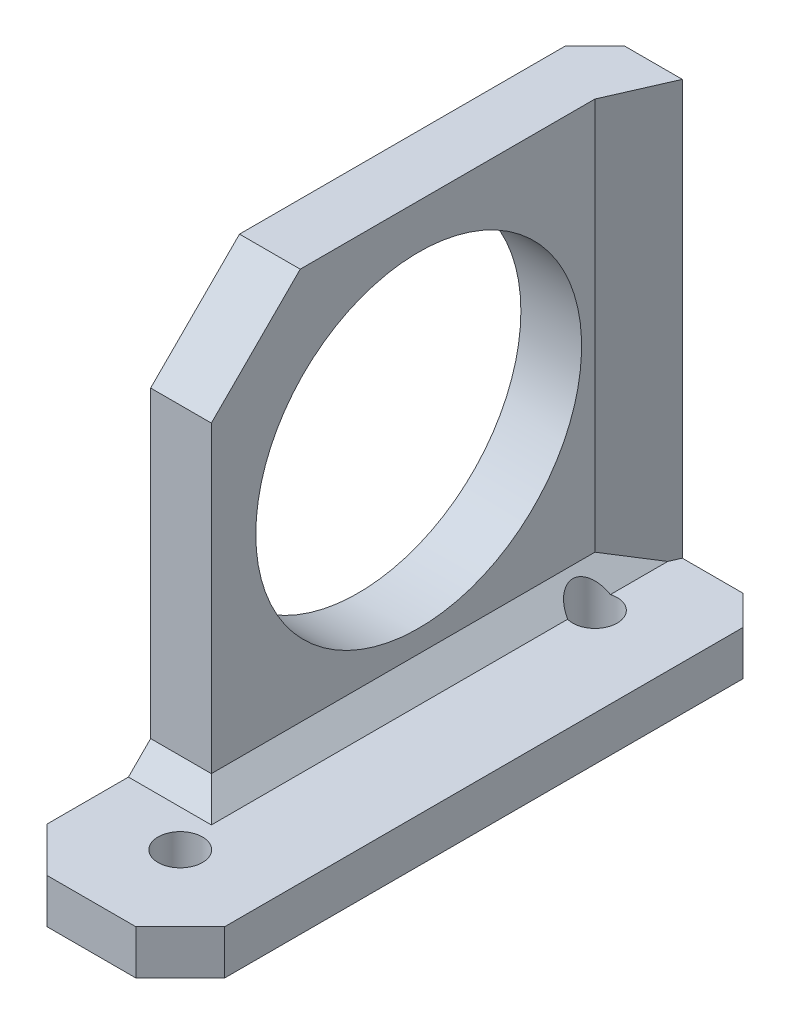
from build123d import *

# Parameters (mm, degrees)
SKETCH1_R                = 1.5
BOSS_EXTRUDE1_DEPTH      = 3
BOSS_EXTRUDE2_DEPTH      = 28
CHAMFER1_SIZE            = 2
SKETCH4_R                = 11
CUT_EXTRUDE1_DEPTH       = 11
CHAMFER2_SIZE            = 6
CHAMFER2_OF_MIRROR3_SIZE = 6
CHAMFER3_SIZE            = 2
SKETCH5_W                = 30
SKETCH5_H                = 28
CUT_EXTRUDE2_DEPTH       = 11
CHAMFER4_SIZE            = 1.5


with BuildPart() as part:
    # Sketch1 → Boss-Extrude1 (new body)
    with BuildSketch(Plane(origin=(0, 0, 0), x_dir=(1, 0, 0), z_dir=(0, 1, 0))):
        Polygon((-6, 20), (6, 20), (6, -17), (3, -20), (-3, -20), (-6, -17), align=None)
        with Locations(Location((0, 14, 0), (0, 0, 270))):
            Circle(SKETCH1_R, mode=Mode.SUBTRACT)
        with Locations(Location((0, -14, 0), (0, 0, 270))):
            Circle(SKETCH1_R, mode=Mode.SUBTRACT)
    extrude(amount=BOSS_EXTRUDE1_DEPTH)

    # Sketch2 → Boss-Extrude2 (add)
    with BuildSketch(Plane(origin=(0, 3, 0), x_dir=(1, 0, 0), z_dir=(0, 1, 0))):
        Polygon((6, -10), (6, 20), (0.1, 20), (1.9, 15.9), (1.9, -10), align=None)
    boss_extrude2 = extrude(amount=BOSS_EXTRUDE2_DEPTH)

    # Chamfer1
    chamfer1_edges = [part.edges().sort_by_distance(p)[0] for p in [
        (6, 15.5, -20),
    ]]
    chamfer(chamfer1_edges, length=CHAMFER1_SIZE)

    # Sketch4 → Cut-Extrude1 (cut)
    with BuildSketch(Plane(origin=(6, 0, 0), x_dir=(0, 0, -1), z_dir=(1, 0, 0))):
        with Locations((4, 17)):
            Circle(SKETCH4_R)
    cut_extrude1 = extrude(amount=-CUT_EXTRUDE1_DEPTH, mode=Mode.SUBTRACT)

    # Chamfer2
    chamfer2_edges = [part.edges().sort_by_distance(p)[0] for p in [
        (3.95, 31, 10),
    ]]
    chamfer(chamfer2_edges, length=CHAMFER2_SIZE)

    # Mirror3: Boss-Extrude2, Cut-Extrude1 across plane
    add(boss_extrude2.mirror(Plane(origin=(0, 0, 0), x_dir=(0, 0, 1), z_dir=(1, 0, 0))))
    add(cut_extrude1.mirror(Plane(origin=(0, 0, 0), x_dir=(0, 0, 1), z_dir=(1, 0, 0))), mode=Mode.SUBTRACT)

    # Chamfer2 of Mirror3
    chamfer2_of_mirror3_edges = [part.edges().sort_by_distance(p)[0] for p in [
        (-3.95, 31, 10),
    ]]
    chamfer(chamfer2_of_mirror3_edges, length=CHAMFER2_OF_MIRROR3_SIZE)

    # Chamfer3
    chamfer3_edges = [part.edges().sort_by_distance(p)[0] for p in [
        (-6, 15.5, -20),
    ]]
    chamfer(chamfer3_edges, length=CHAMFER3_SIZE)

    # Sketch5 → Cut-Extrude2 (cut)
    with BuildSketch(Plane(origin=(0, 0, 0), x_dir=(0, 0, -1), z_dir=(1, 0, 0))):
        with Locations((5, 17)):
            Rectangle(SKETCH5_W, SKETCH5_H)
    extrude(amount=CUT_EXTRUDE2_DEPTH, mode=Mode.SUBTRACT)

    # Chamfer4
    # the kernel refuses this chamfer: 1.5 mm, written as the material it adds along each edge
    with BuildSketch(Plane(origin=(-1.9, 3, 10), x_dir=(0, -0.02749587661058648, 0.9996219169112968), z_dir=(-1, 0, 0))) as chamfer4_piece_1:
        Polygon((CHAMFER4_SIZE * 0.999621916911, CHAMFER4_SIZE * 0.0274958766106), (-CHAMFER4_SIZE * 0.0274958766106, CHAMFER4_SIZE * 0.999621916911), (0, 0), align=None)
    extrude(amount=4.1)
    with BuildSketch(Plane(origin=(-1.9, 3, -19.757524482), x_dir=(-0.02749587661058635, 0.9996219169112968, 0), z_dir=(0, 0, 1))) as chamfer4_piece_2_section:
        Polygon((CHAMFER4_SIZE * 0.999621916911, -CHAMFER4_SIZE * 0.0274958766106), (-CHAMFER4_SIZE * 0.0274958766106, -CHAMFER4_SIZE * 0.999621916911), (0, 0), align=None)
    chamfer4_piece_2 = extrude(amount=29.757524482, mode=Mode.PRIVATE)
    chamfer4_piece_2 = chamfer4_piece_2 - Plane(origin=(0, 3.558405008, -14), x_dir=(0, 0, 1), z_dir=(0, -1, 0)) * Cylinder(1.5, 66, mode=Mode.PRIVATE)
    add(chamfer4_piece_2)
    with BuildSketch(Plane(origin=(-1.9, 3, -19.757524482), x_dir=(-0.02749587661058635, 0.9996219169112968, 0), z_dir=(0, 0, 1))) as chamfer4_piece_3a_section:
        Polygon((CHAMFER4_SIZE * 0.999621916911, -CHAMFER4_SIZE * 0.0274958766106), (-CHAMFER4_SIZE * 0.0274958766106, -CHAMFER4_SIZE * 0.999621916911), (0, 0), align=None)
    chamfer4_piece_3a = extrude(amount=33.615048964, mode=Mode.PRIVATE)
    chamfer4_piece_3a = split(chamfer4_piece_3a, bisect_by=Plane(origin=(-1.452850979, 3.51967463, 10), z_dir=(0, 0, 1)), keep=Keep.TOP, mode=Mode.PRIVATE)
    chamfer4_piece_3a = chamfer4_piece_3a - Plane(origin=(0, 3.51967463, 14), x_dir=(0, 0, 1), z_dir=(0, -1, 0)) * Cylinder(1.5, 74, mode=Mode.PRIVATE)
    with BuildSketch(Plane(origin=(1.957524482, 3, 10), x_dir=(0, -0.02749587661058648, 0.9996219169112968), z_dir=(-1, 0, 0))) as chamfer4_piece_3b_section:
        Polygon((CHAMFER4_SIZE * 0.999621916911, CHAMFER4_SIZE * 0.0274958766106), (-CHAMFER4_SIZE * 0.0274958766106, CHAMFER4_SIZE * 0.999621916911), (0, 0), align=None)
    chamfer4_piece_3b = extrude(amount=7.957524482, mode=Mode.PRIVATE)
    chamfer4_piece_3b = split(chamfer4_piece_3b, bisect_by=Plane(origin=(-1.9, 3.49469044, 10.49469044), z_dir=(1, 0, 0)), keep=Keep.TOP, mode=Mode.PRIVATE)
    chamfer4_piece_3 = chamfer4_piece_3a & chamfer4_piece_3b
    add(chamfer4_piece_3)


solid = part.part
